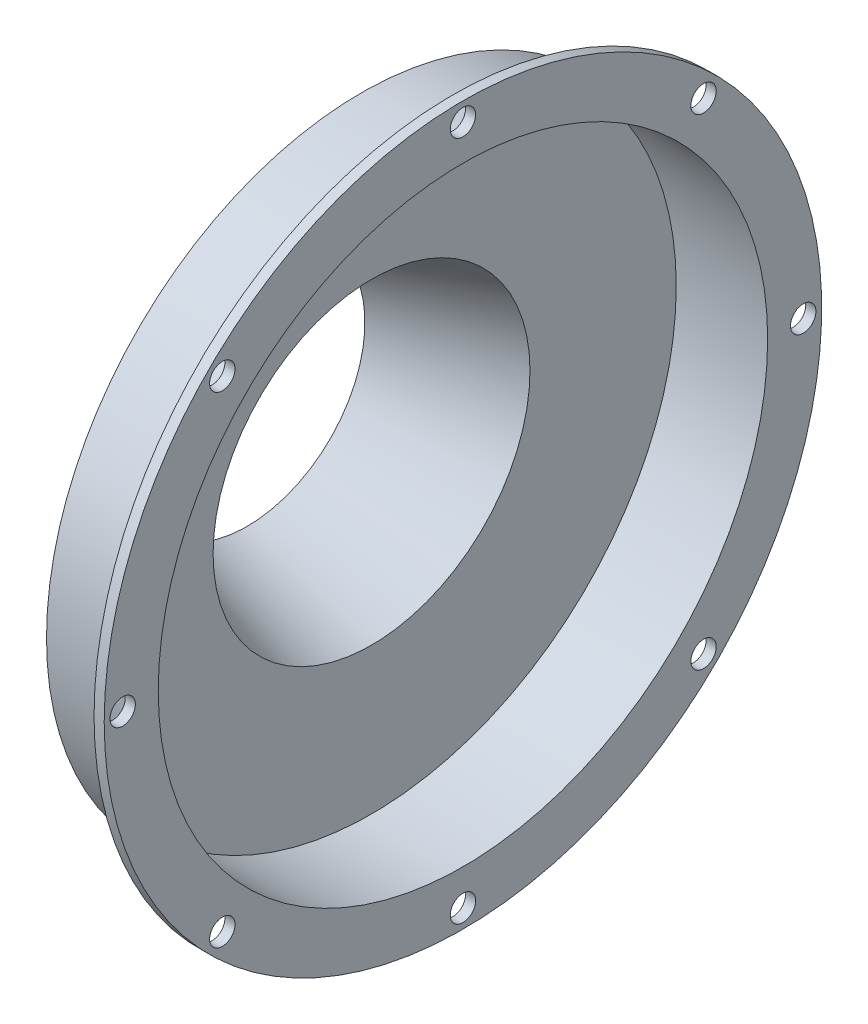
from build123d import *

# Parameters (mm, degrees)
SKETCH2_R          = 3.175
CUT_EXTRUDE1_DEPTH = 2.54
CIRPATTERN1_COUNT  = 8


with BuildPart() as part:
    # Sketch1 → Revolve1 (revolve)
    with BuildSketch(Plane.XY):
        Polygon((0, 29.464), (31.115, 39.624), (31.115, 76.2), (53.975, 76.2), (53.975, 89.7128), (51.435, 89.7128), (51.435, 78.74), (28.575, 78.74), (28.575, 41.466593541), (-0.788420526, 31.878537859), align=None)
    revolve(axis=Axis((0, 0, 0), (1, 0, 0)))

    # Sketch2 → Cut-Extrude1 (cut)
    with BuildSketch(Plane.ZY.offset(-51.435)):
        with Locations((0, 85.09)):
            Circle(SKETCH2_R)
    cut_extrude1 = extrude(amount=-CUT_EXTRUDE1_DEPTH, mode=Mode.SUBTRACT)

    # CirPattern1: Cut-Extrude1 ×8 about axis
    cirpattern1_axis = Axis((51.435, 0, 0), (-1, 0, 0))
    for i in range(1, CIRPATTERN1_COUNT):
        add(cut_extrude1.rotate(cirpattern1_axis, i * 360 / CIRPATTERN1_COUNT), mode=Mode.SUBTRACT)


solid = part.part
